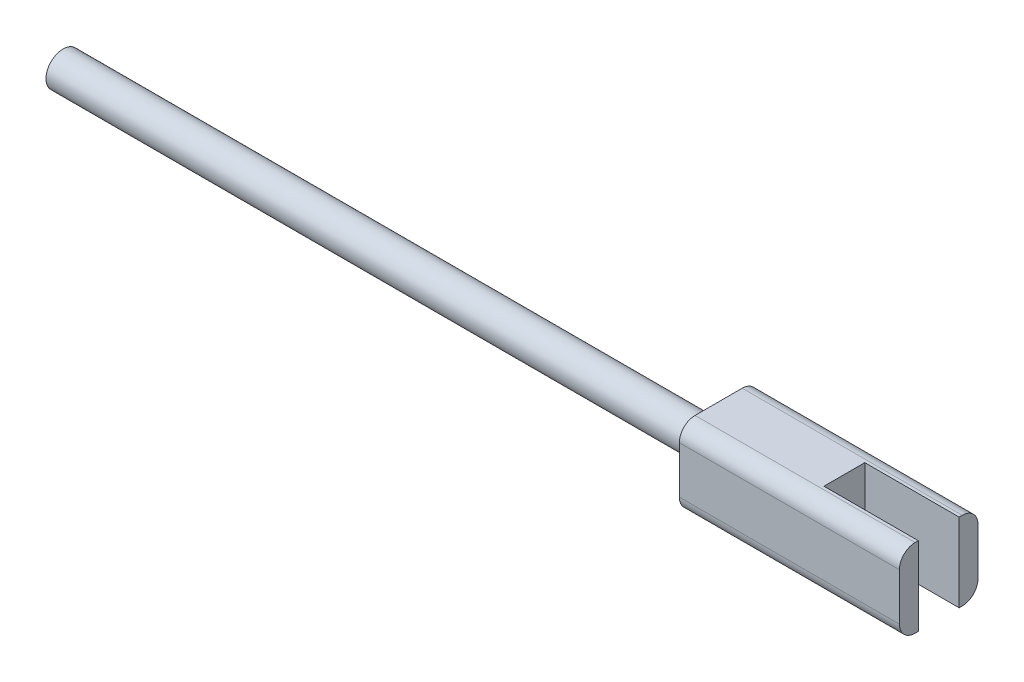
from build123d import *

# Parameters (mm, degrees)
SKETCH1_R               = 1.09
BOSS_EXTRUDE1_DEPTH     = 43.702
BOSS_EXTRUDE2_DEPTH     = 14
CUT_EXTRUDE1_DEPTH      = 56.814091447
CUT_EXTRUDE1_DEPTH_BACK = 56.814091447
SKETCH3_W               = 7
SKETCH3_H               = 2.6


with BuildPart() as part:
    # Sketch1 → Boss-Extrude1 (new body)
    with BuildSketch(Plane(origin=(0, 0, 0), x_dir=(0, 0, -1), z_dir=(1, 0, 0))):
        Circle(SKETCH1_R)
    extrude(amount=BOSS_EXTRUDE1_DEPTH)

    # Sketch2 → Boss-Extrude2 (add)
    with BuildSketch(Plane(origin=(41.702, 0, 0), x_dir=(0, 0, -1), z_dir=(1, 0, 0))):
        with BuildLine():
            Line((-1.5, -2.5), (1.5, -2.5))
            ThreePointArc((1.5, -2.5), (2.207106781, -2.207106781), (2.5, -1.5))
            Line((2.5, -1.5), (2.5, 1.5))
            ThreePointArc((2.5, 1.5), (2.207106781, 2.207106781), (1.5, 2.5))
            Line((1.5, 2.5), (-1.5, 2.5))
            ThreePointArc((-1.5, 2.5), (-2.207106781, 2.207106781), (-2.5, 1.5))
            Line((-2.5, 1.5), (-2.5, -1.5))
            ThreePointArc((-2.5, -1.5), (-2.207106781, -2.207106781), (-1.5, -2.5))
        make_face()
    extrude(amount=BOSS_EXTRUDE2_DEPTH)

    # Sketch3 → Cut-Extrude1 (cut, two sides: drawn at the far end of the back side and taken through both)
    with BuildSketch(Plane(origin=(0, 0, 0), x_dir=(1, 0, 0), z_dir=(0, 1, 0)).offset(-CUT_EXTRUDE1_DEPTH_BACK)):
        with Locations((53.202, 0)):
            Rectangle(SKETCH3_W, SKETCH3_H)
    extrude(amount=CUT_EXTRUDE1_DEPTH + CUT_EXTRUDE1_DEPTH_BACK, mode=Mode.SUBTRACT)


solid = part.part
